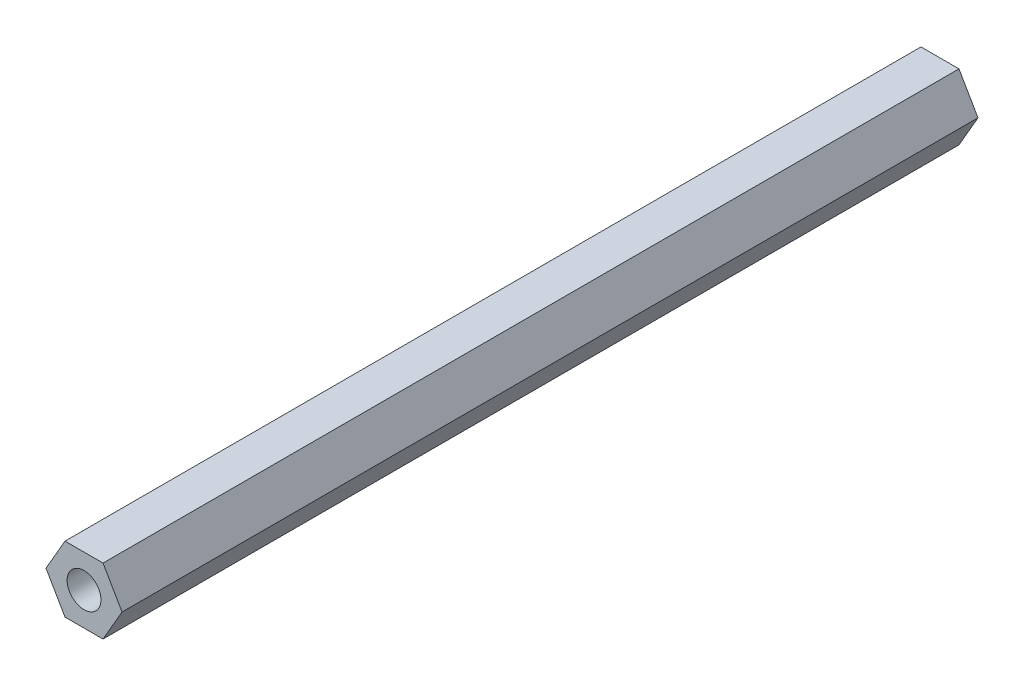
from build123d import *

# Parameters (mm, degrees)
SKETCH1_R           = 3.2639
BOSS_EXTRUDE1_DEPTH = 165.1


with BuildPart() as part:
    # Sketch1 → Boss-Extrude1 (new body)
    with BuildSketch(Plane.XY):
        Polygon((-3.666174209, 6.35), (-7.332348419, 0), (-3.666174209, -6.35), (3.666174209, -6.35), (7.332348419, 0), (3.666174209, 6.35), align=None)
        Circle(SKETCH1_R, mode=Mode.SUBTRACT)
    extrude(amount=BOSS_EXTRUDE1_DEPTH)


solid = part.part
